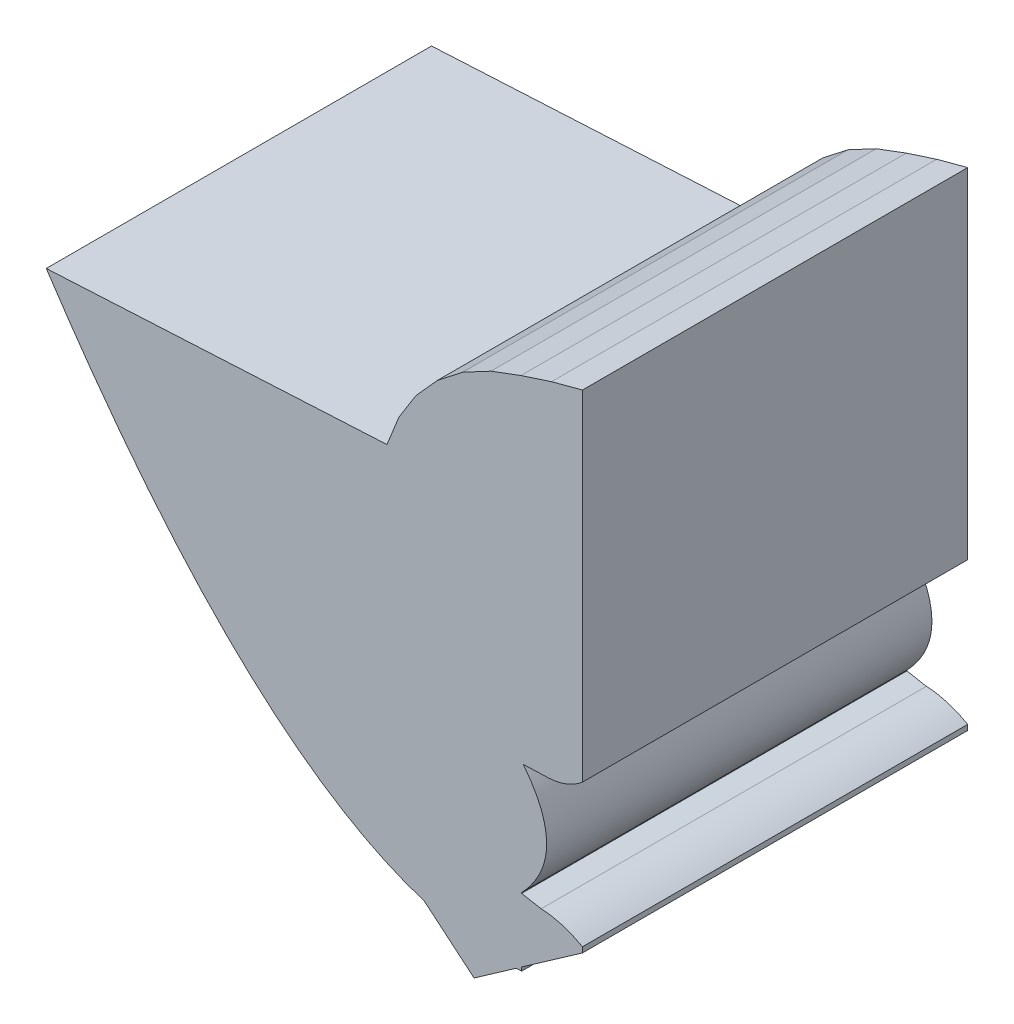
from build123d import *

# Parameters (mm, degrees)
CROQUIS_BASE_DEPTH              = 7.21
LENTE_PPAL_1_REACH              = 29.232
LENTE_PPAL_1_DIRECTION_2_REACH  = 29.232
LENTE_PPAL_2_DEPTH              = 28.232395361
LENTE_PPAL_2_DEPTH_BACK         = 28.232395361
CROQUIS9_3_OUTSIDE_W            = 30.105
CROQUIS9_3_OUTSIDE_H            = 25.977
LENTE_FRONTAL_REACH             = 25.468
LENTE_FRONTAL_DIRECTION_2_REACH = 25.468
LENTE_TRASERA_REACH             = 28.339
LENTE_TRASERA_DIRECTION_2_REACH = 28.339


with BuildPart() as part:
    # Croquis1 → croquis base (new, symmetric)
    with BuildSketch(Plane.XY):
        with BuildLine():
            Line((-6.994875026, 10.477389992), (-8.981845695, 12.608155172))
            Line((-8.981845695, 12.608155172), (-23.035921146, 11.871612288))
            Line((-23.035921146, 11.871612288), (-23.035921146, 11.54013782))
            ThreePointArc((-23.035921146, 11.54013782), (-20.949684518, 9.582335705), (-18.945192114, 7.540918896))
            add(Edge.make_bspline(
                [(-18.945192114, 7.540918896), (-10.215008384, -3.697644103), (-2.846604825, -5.059081104)],
                knots=[0.497667241, 0.497667241, 0.497667241, 0.49955428, 0.49955428, 0.49955428], degree=2))
            add(Edge.make_bspline(
                [(-2.846604825, -5.059081104), (-2.498165198, -4.87297933), (-2.177330417, -4.684462446)],
                knots=[0.498812075, 0.498812075, 0.498812075, 0.498911556, 0.498911556, 0.498911556], degree=2))
            Line((-2.177330418, -4.684462446), (-2.177330418, 6.186438919))
            add(Edge.make_bspline(
                [(-2.177330418, 6.186438919), (-4.063319702, 8.141636997), (-6.994875026, 10.477389992)],
                knots=[0.50138293, 0.50138293, 0.50138293, 0.502013312, 0.502013312, 0.502013312], degree=2))
        make_face()
    extrude(amount=CROQUIS_BASE_DEPTH, both=True)

    # lente ppal 1: up to this face of the body (flat: up to its plane)
    lente_ppal_1_end = Plane(part.part.faces().sort_by_distance((-10.153546236, 5.159655324, 7.21))[0])
    # Croquis9 → lente ppal 1 (add, up to the picked face)
    with BuildSketch(Plane.XY, mode=Mode.PRIVATE) as lente_ppal_1_sk1:
        with BuildLine():
            Line((-2.177330418, -4.388282022), (-2.177330418, -1.840420572))
            add(Edge.make_bspline(
                [(-2.177330418, 2.424232079), (-0.304369247, 0.128042884), (-2.177330418, -1.840420572)],
                knots=[0, 0, 0, 1, 1, 1], degree=2))
            Line((-2.177330418, 2.424232079), (-2.177330418, 6.082860828))
            Line((-2.177330418, 6.082860828), (-10.309820395, 10))
            Line((-10.309820395, 10), (-19.969359014, 9.493765032))
            add(Edge.make_bspline(
                [(-2.177330418, -4.388282022), (-10.4130765, -4.994158739), (-19.969359014, 9.493765032)],
                knots=[0, 0, 0, 1, 1, 1], degree=2))
        make_face()
    lente_ppal_1_tool1 = split(extrude(lente_ppal_1_sk1.sketch, amount=LENTE_PPAL_1_REACH, mode=Mode.PRIVATE), bisect_by=lente_ppal_1_end, keep=Keep.BOTH, mode=Mode.PRIVATE)
    add(lente_ppal_1_tool1.solids().sort_by(Axis((-9.106368, 3.599172, 0), (0, 0, 1)))[0])

    # lente ppal 1 direction 2: up to this face of the body (flat: up to its plane)
    lente_ppal_1_direction_2_end = Plane(part.part.faces().sort_by_distance((-10.153546236, 5.159655324, -7.21))[0])
    # Croquis9 → lente ppal 1 direction 2 (add, up to the picked face)
    with BuildSketch(Plane.XY, mode=Mode.PRIVATE) as lente_ppal_1_direction_2_sk1:
        with BuildLine():
            Line((-2.177330418, -4.388282022), (-2.177330418, -1.840420572))
            add(Edge.make_bspline(
                [(-2.177330418, 2.424232079), (-0.304369247, 0.128042884), (-2.177330418, -1.840420572)],
                knots=[0, 0, 0, 1, 1, 1], degree=2))
            Line((-2.177330418, 2.424232079), (-2.177330418, 6.082860828))
            Line((-2.177330418, 6.082860828), (-10.309820395, 10))
            Line((-10.309820395, 10), (-19.969359014, 9.493765032))
            add(Edge.make_bspline(
                [(-2.177330418, -4.388282022), (-10.4130765, -4.994158739), (-19.969359014, 9.493765032)],
                knots=[0, 0, 0, 1, 1, 1], degree=2))
        make_face()
    lente_ppal_1_direction_2_tool1 = split(extrude(lente_ppal_1_direction_2_sk1.sketch, amount=-LENTE_PPAL_1_DIRECTION_2_REACH, mode=Mode.PRIVATE), bisect_by=lente_ppal_1_direction_2_end, keep=Keep.BOTH, mode=Mode.PRIVATE)
    add(lente_ppal_1_direction_2_tool1.solids().sort_by(Axis((-9.106368, 3.599172, 0), (0, 0, -1)))[0])

    # Croquis9<3> outside → lente ppal 2 (cut, two sides: drawn at the far end of the back side and taken through both)
    with BuildSketch(Plane.XY.offset(-LENTE_PPAL_2_DEPTH_BACK)):
        with Locations((-12.1385, 3.7745)):
            Rectangle(CROQUIS9_3_OUTSIDE_W, CROQUIS9_3_OUTSIDE_H)
        with BuildLine():
            Line((-2.177330418, -1.840420572), (-2.177330418, -4.388282022))
            add(Edge.make_bspline(
                [(-2.177330418, -4.388282022), (-10.4130765, -4.994158739), (-19.969359014, 9.493765032)],
                knots=[0, 0, 0, 1, 1, 1], degree=2))
            Line((-19.969359014, 9.493765032), (-10.309820395, 10))
            Line((-10.309820395, 10), (-2.177330418, 6.082860828))
            Line((-2.177330418, 6.082860828), (-2.177330418, 2.424232079))
            add(Edge.make_bspline(
                [(-2.177330418, 2.424232079), (-0.304369247, 0.128042884), (-2.177330418, -1.840420572)],
                knots=[0, 0, 0, 1, 1, 1], degree=2))
        make_face(mode=Mode.SUBTRACT)
    extrude(amount=LENTE_PPAL_2_DEPTH + LENTE_PPAL_2_DEPTH_BACK, mode=Mode.SUBTRACT)

    # lente frontal: up to this face of the body (flat: up to its plane)
    lente_frontal_end = Plane(part.part.faces().sort_by_distance((-9.106367081, 3.599171888, 7.21))[0])
    # Croquis8 → lente frontal (add, up to the picked face)
    with BuildSketch(Plane.XY, mode=Mode.PRIVATE) as lente_frontal_sk1:
        with BuildLine():
            Line((0.1, 2.877673418), (0.1, 15.587903347))
            Line((0.1, 15.587903347), (-1.059110992, 15.277320493))
            Line((-1.059110992, 15.277320493), (-2.200378811, 14.9065001))
            Line((-2.200378811, 14.9065001), (-3.324385438, 14.486251242))
            Line((-3.324385438, 14.486251242), (-4.38392255, 13.922885367))
            Line((-4.38392255, 13.922885367), (-5.329535454, 13.184091597))
            Line((-5.329535454, 13.184091597), (-6.132492182, 12.292317806))
            Line((-6.132492182, 12.292317806), (-6.768395299, 11.274660091))
            Line((-6.768395299, 11.274660091), (-7.217923211, 10.162039465))
            Line((-7.217923211, 10.162039465), (-10.309820395, 10))
            Line((-10.309820395, 10), (-2.177330418, 2.342487007))
            Line((-2.177330418, 2.342487007), (-1.190501641, 2.376947827))
            add(Edge.make_bspline(
                [(-1.190501641, 2.376947827), (-0.463368169, 2.402339888), (0.1, 2.877673418)],
                knots=[0, 0, 0, 1, 1, 1], degree=2))
        make_face()
    lente_frontal_tool1 = split(extrude(lente_frontal_sk1.sketch, amount=LENTE_FRONTAL_REACH, mode=Mode.PRIVATE), bisect_by=lente_frontal_end, keep=Keep.BOTH, mode=Mode.PRIVATE)
    add(lente_frontal_tool1.solids().sort_by(Axis((-3.290182, 8.96302, 0), (0, 0, 1)))[0])

    # lente frontal direction 2: up to this face of the body (flat: up to its plane)
    lente_frontal_direction_2_end = Plane(part.part.faces().sort_by_distance((-9.106367081, 3.599171888, -7.21))[0])
    # Croquis8 → lente frontal direction 2 (add, up to the picked face)
    with BuildSketch(Plane.XY, mode=Mode.PRIVATE) as lente_frontal_direction_2_sk1:
        with BuildLine():
            Line((0.1, 2.877673418), (0.1, 15.587903347))
            Line((0.1, 15.587903347), (-1.059110992, 15.277320493))
            Line((-1.059110992, 15.277320493), (-2.200378811, 14.9065001))
            Line((-2.200378811, 14.9065001), (-3.324385438, 14.486251242))
            Line((-3.324385438, 14.486251242), (-4.38392255, 13.922885367))
            Line((-4.38392255, 13.922885367), (-5.329535454, 13.184091597))
            Line((-5.329535454, 13.184091597), (-6.132492182, 12.292317806))
            Line((-6.132492182, 12.292317806), (-6.768395299, 11.274660091))
            Line((-6.768395299, 11.274660091), (-7.217923211, 10.162039465))
            Line((-7.217923211, 10.162039465), (-10.309820395, 10))
            Line((-10.309820395, 10), (-2.177330418, 2.342487007))
            Line((-2.177330418, 2.342487007), (-1.190501641, 2.376947827))
            add(Edge.make_bspline(
                [(-1.190501641, 2.376947827), (-0.463368169, 2.402339888), (0.1, 2.877673418)],
                knots=[0, 0, 0, 1, 1, 1], degree=2))
        make_face()
    lente_frontal_direction_2_tool1 = split(extrude(lente_frontal_direction_2_sk1.sketch, amount=-LENTE_FRONTAL_DIRECTION_2_REACH, mode=Mode.PRIVATE), bisect_by=lente_frontal_direction_2_end, keep=Keep.BOTH, mode=Mode.PRIVATE)
    add(lente_frontal_direction_2_tool1.solids().sort_by(Axis((-3.290182, 8.96302, 0), (0, 0, -1)))[0])

    # lente trasera: up to this face of the body (flat: up to its plane)
    lente_trasera_end = Plane(part.part.faces().sort_by_distance((-7.357064552, 5.305385386, 7.21))[0])
    # Croquis11 → lente trasera (add, up to the picked face)
    with BuildSketch(Plane.XY, mode=Mode.PRIVATE) as lente_trasera_sk1:
        with BuildLine():
            Line((0.1, -2.458811066), (0.1, -2.658811066))
            Line((0.1, -2.658811066), (-3.957638313, -5.5))
            Line((-3.957638313, -5.5), (-10.029650265, -0.404977011))
            Line((-10.029650265, -0.404977011), (-1.447650757, -2.001370848))
            add(Edge.make_bspline(
                [(-1.447650757, -2.001370848), (-0.67030688, -2.028516294), (0.1, -2.458811066)],
                knots=[0, 0, 0, 1, 1, 1], degree=2))
        make_face()
    lente_trasera_tool1 = split(extrude(lente_trasera_sk1.sketch, amount=LENTE_TRASERA_REACH, mode=Mode.PRIVATE), bisect_by=lente_trasera_end, keep=Keep.BOTH, mode=Mode.PRIVATE)
    add(lente_trasera_tool1.solids().sort_by(Axis((-4.514125, -2.758798, 0), (0, 0, 1)))[0])

    # lente trasera direction 2: up to this face of the body (flat: up to its plane)
    lente_trasera_direction_2_end = Plane(part.part.faces().sort_by_distance((-7.357064552, 5.305385386, -7.21))[0])
    # Croquis11 → lente trasera direction 2 (add, up to the picked face)
    with BuildSketch(Plane.XY, mode=Mode.PRIVATE) as lente_trasera_direction_2_sk1:
        with BuildLine():
            Line((0.1, -2.458811066), (0.1, -2.658811066))
            Line((0.1, -2.658811066), (-3.957638313, -5.5))
            Line((-3.957638313, -5.5), (-10.029650265, -0.404977011))
            Line((-10.029650265, -0.404977011), (-1.447650757, -2.001370848))
            add(Edge.make_bspline(
                [(-1.447650757, -2.001370848), (-0.67030688, -2.028516294), (0.1, -2.458811066)],
                knots=[0, 0, 0, 1, 1, 1], degree=2))
        make_face()
    lente_trasera_direction_2_tool1 = split(extrude(lente_trasera_direction_2_sk1.sketch, amount=-LENTE_TRASERA_DIRECTION_2_REACH, mode=Mode.PRIVATE), bisect_by=lente_trasera_direction_2_end, keep=Keep.BOTH, mode=Mode.PRIVATE)
    add(lente_trasera_direction_2_tool1.solids().sort_by(Axis((-4.514125, -2.758798, 0), (0, 0, -1)))[0])


solid = part.part
